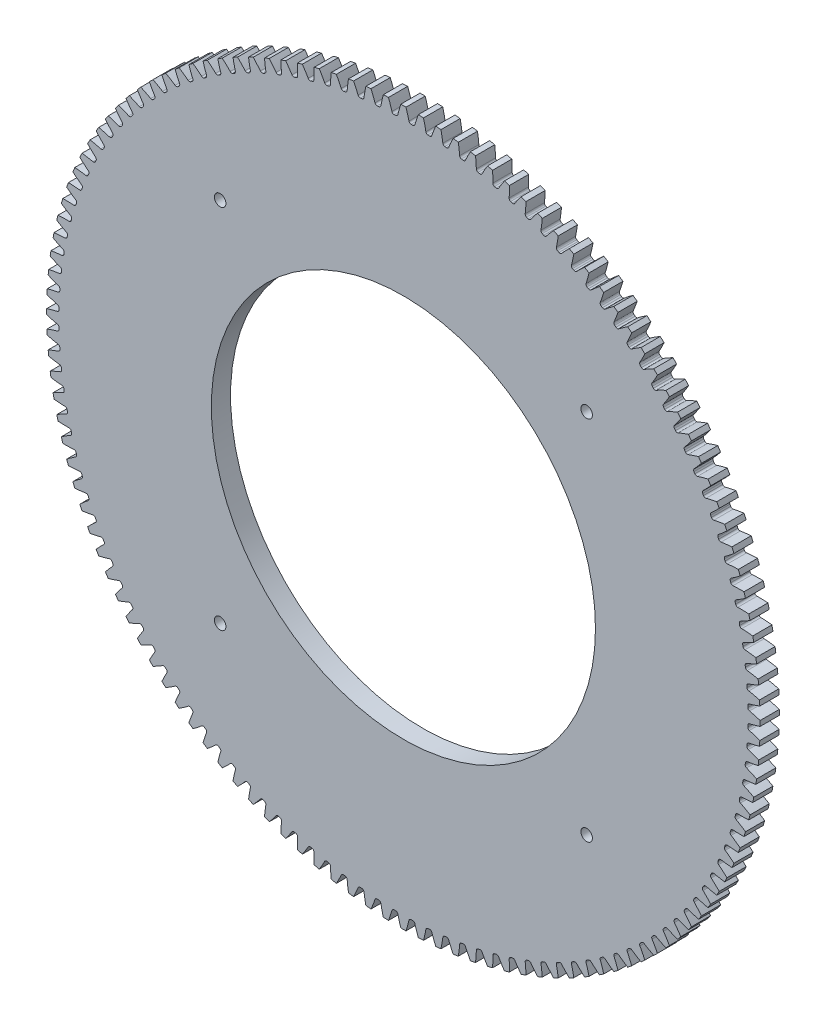
from build123d import *

# Parameters (mm, degrees)
SKETCH3_R         = 117.928571429
GEARBODY_DEPTH    = 6.35
TOOTHCUT_DEPTH    = 167.897029387
CIRPATTERN1_COUNT = 128
BOREDIA_R         = 63.5
BOREDIA_R_2       = 1.905
BORE_DEPTH        = 12700


with BuildPart() as part:
    # Sketch3 → gearBody (new body)
    with BuildSketch(Plane.XY):
        Circle(SKETCH3_R)
    extrude(amount=GEARBODY_DEPTH)

    # Sketch2 → toothCut (cut, through all)
    with BuildSketch(Plane.XY):
        with BuildLine():
            ThreePointArc((113.845005822, -3.068181659), (113.852092685, -2.792862459), (113.858513725, -2.517526926))
            ThreePointArc((113.858513725, -2.517526926), (114.020135625, -2.076774973), (114.41773049, -1.827170796))
            ThreePointArc((114.41773049, -1.827170796), (129.939007798, 5.038787736), (141.921218776, 17.058690227))
            ThreePointArc((141.921218776, 17.058690227), (142.899766558, -3.505419918), (140.914101738, -23.996816089))
            ThreePointArc((140.914101738, -23.996816089), (129.535659393, -11.40386228), (114.369700614, -3.785126811))
            ThreePointArc((114.369700614, -3.785126811), (113.984822494, -3.516328086), (113.845005822, -3.068181659))
        make_face()
    toothcut = extrude(amount=TOOTHCUT_DEPTH, mode=Mode.SUBTRACT)

    # CirPattern1: toothCut ×128 about axis
    cirpattern1_axis = Axis((0, 0, 0), (0, 0, 1))
    for i in range(1, CIRPATTERN1_COUNT):
        add(toothcut.rotate(cirpattern1_axis, i * 360 / CIRPATTERN1_COUNT), mode=Mode.SUBTRACT)

    # boreDia → bore (cut, symmetric)
    with BuildSketch(Plane.XY):
        Circle(BOREDIA_R)
        with Locations((60.579, 60.579)):
            Circle(BOREDIA_R_2)
        with Locations((-60.579, 60.579)):
            Circle(BOREDIA_R_2)
        with Locations((-60.579, -60.579)):
            Circle(BOREDIA_R_2)
        with Locations((60.579, -60.579)):
            Circle(BOREDIA_R_2)
    extrude(amount=BORE_DEPTH, both=True, mode=Mode.SUBTRACT)


solid = part.part
